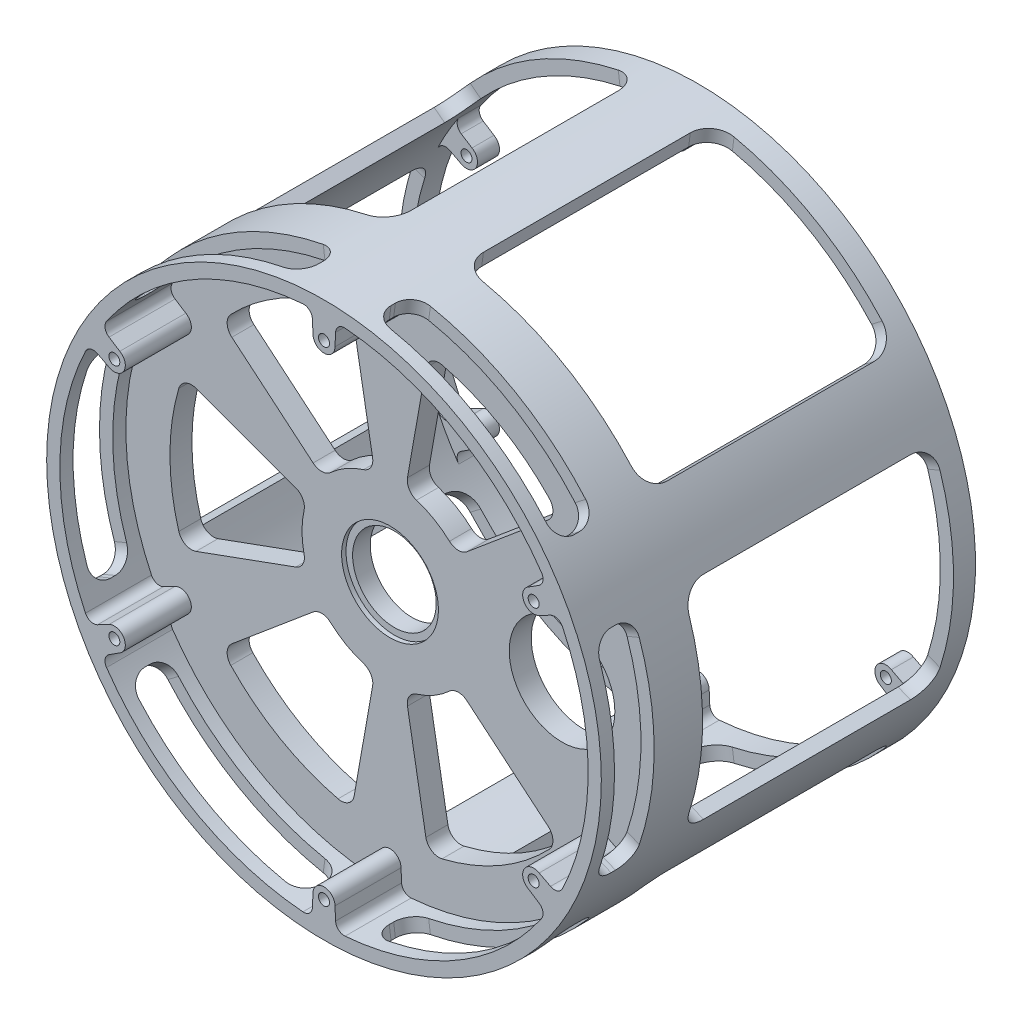
from build123d import *

# Parameters (mm, degrees)
SKETCH_1_R           = 63
SKETCH_1_R_2         = 55
EXTRUDE_1_DEPTH      = 3
SKETCH_3_R           = 63
SKETCH_3_R_2         = 1.25
EXTRUDE_2_DEPTH      = 65
SKETCH_4_R           = 63
CUT_EXTRUDE_2_DEPTH  = 3
SKETCH_5_R           = 63
SKETCH_5_R_2         = 60
EXTRUDE_3_DEPTH      = 3
FILLET_1_R           = 2
CUT_EXTRUDE_START    = -57
CUT_EXTRUDE_3_DEPTH  = 57
FILLET_2_R           = 5
SKETCH_7_R           = 63
EXTRUDE_4_DEPTH      = 5
SKETCH_8_R           = 9.5
CUT_EXTRUDE_4_DEPTH  = 5
SKETCH_9_R           = 11
CUT_EXTRUDE_5_DEPTH  = 1
SKETCH_11_R          = 63
SKETCH_11_R_2        = 1.25
EXTRUDE_6_DEPTH      = 15
FILLET_3_R           = 2
SKETCH_12_R          = 12
CUT_EXTRUDE_6_DEPTH  = 5
CUT_EXTRUDE_START_2  = -9
CUT_EXTRUDE_7_DEPTH  = 9
FILLET_4_R           = 4
CUT_EXTRUDE_8_REACH  = 115.305
FILLET_5_R           = 3
CUT_EXTRUDE_START_3  = 60
SKETCH_16_R          = 60
CUT_EXTRUDE_11_DEPTH = 60


with BuildPart() as part:
    # 草图1 → 凸台-拉伸1 (new body)
    with BuildSketch(Plane.XY):
        Circle(SKETCH_1_R)
        Circle(SKETCH_1_R_2, mode=Mode.SUBTRACT)
    extrude(amount=EXTRUDE_1_DEPTH)

    # 草图3 → 凸台-拉伸2 (add)
    with BuildSketch(Plane.XY.offset(3)):
        Circle(SKETCH_3_R)
        with Locations((0, 55)):
            Circle(SKETCH_3_R_2, mode=Mode.SUBTRACT)
        with Locations((47.631397208, 27.5)):
            Circle(SKETCH_3_R_2, mode=Mode.SUBTRACT)
        with Locations((47.631397208, -27.5)):
            Circle(SKETCH_3_R_2, mode=Mode.SUBTRACT)
        with Locations((0, -55)):
            Circle(SKETCH_3_R_2, mode=Mode.SUBTRACT)
        with Locations((-47.631397208, -27.5)):
            Circle(SKETCH_3_R_2, mode=Mode.SUBTRACT)
        with Locations((-47.631397208, 27.5)):
            Circle(SKETCH_3_R_2, mode=Mode.SUBTRACT)
        with BuildLine():
            Line((-2.5, 55), (-2.724459655, 59.938112413))
            ThreePointArc((-2.724459655, 59.938112413), (-30, 51.961524227), (-50.545698177, 32.328507479))
            Line((-50.545698177, 32.328507479), (-46.381397208, 29.665063509))
            ThreePointArc((-46.381397208, 29.665063509), (-45.466333699, 26.25), (-48.881397208, 25.334936491))
            Line((-48.881397208, 25.334936491), (-53.270157832, 27.609604933))
            ThreePointArc((-53.270157832, 27.609604933), (-60, 0), (-53.270157832, -27.609604933))
            Line((-53.270157832, -27.609604933), (-48.881397208, -25.334936491))
            ThreePointArc((-48.881397208, -25.334936491), (-45.466333699, -26.25), (-46.381397208, -29.665063509))
            Line((-46.381397208, -29.665063509), (-50.545698177, -32.328507479))
            ThreePointArc((-50.545698177, -32.328507479), (-30, -51.961524227), (-2.724459655, -59.938112413))
            Line((-2.724459655, -59.938112413), (-2.5, -55))
            ThreePointArc((-2.5, -55), (0, -52.5), (2.5, -55))
            Line((2.5, -55), (2.724459655, -59.938112413))
            ThreePointArc((2.724459655, -59.938112413), (30, -51.961524227), (50.545698177, -32.328507479))
            Line((50.545698177, -32.328507479), (46.381397208, -29.665063509))
            ThreePointArc((46.381397208, -29.665063509), (45.466333699, -26.25), (48.881397208, -25.334936491))
            Line((48.881397208, -25.334936491), (53.270157832, -27.609604933))
            ThreePointArc((53.270157832, -27.609604933), (60, 0), (53.270157832, 27.609604933))
            Line((53.270157832, 27.609604933), (48.881397208, 25.334936491))
            ThreePointArc((48.881397208, 25.334936491), (45.466333699, 26.25), (46.381397208, 29.665063509))
            Line((46.381397208, 29.665063509), (50.545698177, 32.328507479))
            ThreePointArc((50.545698177, 32.328507479), (30, 51.961524227), (2.724459655, 59.938112413))
            Line((2.724459655, 59.938112413), (2.5, 55))
            ThreePointArc((2.5, 55), (0, 52.5), (-2.5, 55))
        make_face(mode=Mode.SUBTRACT)
    extrude(amount=EXTRUDE_2_DEPTH)

    # 草图4 → 切除-拉伸2 (cut)
    with BuildSketch(Plane(origin=(0, 0, 0), x_dir=(-1, 0, 0), z_dir=(0, 0, -1))):
        Circle(SKETCH_4_R)
    extrude(amount=-CUT_EXTRUDE_2_DEPTH, mode=Mode.SUBTRACT)

    # 草图5 → 凸台-拉伸3 (add)
    with BuildSketch(Plane(origin=(0, 0, 3), x_dir=(-1, 0, 0), z_dir=(0, 0, -1))):
        Circle(SKETCH_5_R)
        Circle(SKETCH_5_R_2, mode=Mode.SUBTRACT)
    extrude(amount=-EXTRUDE_3_DEPTH)

    # 圆角1
    fillet_1_edges = [part.edges().sort_by_distance(p)[0] for p in [
        (-2.724459655, -59.938112413, 35.5),
        (2.724459655, -59.938112413, 35.5),
        (-53.270157832, -27.609604933, 35.5),
        (-50.545698177, -32.328507479, 35.5),
        (-50.545698177, 32.328507479, 35.5),
        (-53.270157832, 27.609604933, 35.5),
        (53.270157832, -27.609604933, 35.5),
        (50.545698177, -32.328507479, 35.5),
        (50.545698177, 32.328507479, 35.5),
        (53.270157832, 27.609604933, 35.5),
        (2.724459655, 59.938112413, 35.5),
        (-2.724459655, 59.938112413, 35.5),
    ]]
    fillet(fillet_1_edges, radius=FILLET_1_R)

    # 草图6 → 切除-拉伸3 (cut)
    with BuildSketch(Plane.XY.offset(65).offset(CUT_EXTRUDE_START)):
        with BuildLine():
            Line((-7.831571533, 59.486691682), (-8.22315011, 62.461026267))
            ThreePointArc((-8.22315011, 62.461026267), (-31.5, 54.559600438), (-49.981260438, 38.351970028))
            Line((-49.981260438, 38.351970028), (-47.601200417, 36.525685741))
            ThreePointArc((-47.601200417, 36.525685741), (-30, 51.961524227), (-7.831571533, 59.486691682))
        make_face()
        with BuildLine():
            Line((7.831571533, 59.486691682), (8.22315011, 62.461026267))
            ThreePointArc((8.22315011, 62.461026267), (31.5, 54.559600438), (49.981260438, 38.351970028))
            Line((49.981260438, 38.351970028), (47.601200417, 36.525685741))
            ThreePointArc((47.601200417, 36.525685741), (30, 51.961524227), (7.831571533, 59.486691682))
        make_face()
        with BuildLine():
            Line((55.432771951, 22.961005942), (58.204410548, 24.109056239))
            ThreePointArc((58.204410548, 24.109056239), (63, 0), (58.204410548, -24.109056239))
            Line((58.204410548, -24.109056239), (55.432771951, -22.961005942))
            ThreePointArc((55.432771951, -22.961005942), (60, 0), (55.432771951, 22.961005942))
        make_face()
        with BuildLine():
            Line((47.601200417, -36.525685741), (49.981260438, -38.351970028))
            ThreePointArc((49.981260438, -38.351970028), (31.5, -54.559600438), (8.22315011, -62.461026267))
            Line((8.22315011, -62.461026267), (7.831571533, -59.486691682))
            ThreePointArc((7.831571533, -59.486691682), (30, -51.961524227), (47.601200417, -36.525685741))
        make_face()
        with BuildLine():
            Line((-7.831571533, -59.486691682), (-8.22315011, -62.461026267))
            ThreePointArc((-8.22315011, -62.461026267), (-31.5, -54.559600438), (-49.981260438, -38.351970028))
            Line((-49.981260438, -38.351970028), (-47.601200417, -36.525685741))
            ThreePointArc((-47.601200417, -36.525685741), (-30, -51.961524227), (-7.831571533, -59.486691682))
        make_face()
        with BuildLine():
            Line((-55.432771951, -22.961005942), (-58.204410548, -24.109056239))
            ThreePointArc((-58.204410548, -24.109056239), (-63, 0), (-58.204410548, 24.109056239))
            Line((-58.204410548, 24.109056239), (-55.432771951, 22.961005942))
            ThreePointArc((-55.432771951, 22.961005942), (-60, 0), (-55.432771951, -22.961005942))
        make_face()
    extrude(amount=CUT_EXTRUDE_3_DEPTH, mode=Mode.SUBTRACT)

    # 圆角2
    fillet_2_edges = [part.edges().sort_by_distance(p)[0] for p in [
        (48.791230428, 37.438827884, 65),
        (8.027360822, 60.973858974, 65),
        (8.027360822, 60.973858974, 8),
        (48.791230428, 37.438827884, 8),
        (-8.027360822, 60.973858974, 65),
        (-48.791230428, 37.438827884, 65),
        (-48.791230428, 37.438827884, 8),
        (-8.027360822, 60.973858974, 8),
        (-56.818591249, 23.53503109, 65),
        (-56.818591249, -23.53503109, 65),
        (-56.818591249, -23.53503109, 8),
        (-56.818591249, 23.53503109, 8),
        (-48.791230428, -37.438827884, 65),
        (-8.027360822, -60.973858974, 65),
        (-8.027360822, -60.973858974, 8),
        (-48.791230428, -37.438827884, 8),
        (8.027360822, -60.973858974, 65),
        (48.791230428, -37.438827884, 65),
        (48.791230428, -37.438827884, 8),
        (8.027360822, -60.973858974, 8),
        (56.818591249, -23.53503109, 65),
        (56.818591249, 23.53503109, 65),
        (56.818591249, 23.53503109, 8),
        (56.818591249, -23.53503109, 8),
    ]]
    fillet(fillet_2_edges, radius=FILLET_2_R)

    # 草图7 → 凸台-拉伸4 (add)
    with BuildSketch(Plane.XY.offset(68)):
        Circle(SKETCH_7_R)
    extrude(amount=EXTRUDE_4_DEPTH)

    # 草图8 → 切除-拉伸4 (cut)
    with BuildSketch(Plane.XY.offset(73)):
        Circle(SKETCH_8_R)
    extrude(amount=-CUT_EXTRUDE_4_DEPTH, mode=Mode.SUBTRACT)

    # 草图9 → 切除-拉伸5 (cut)
    with BuildSketch(Plane.XY.offset(73)):
        Circle(SKETCH_9_R)
    extrude(amount=-CUT_EXTRUDE_5_DEPTH, mode=Mode.SUBTRACT)

    # 草图11 → 凸台-拉伸6 (add)
    with BuildSketch(Plane.XY.offset(73)):
        Circle(SKETCH_11_R)
        with Locations((0, 55)):
            Circle(SKETCH_11_R_2, mode=Mode.SUBTRACT)
        with Locations((47.631397208, 27.5)):
            Circle(SKETCH_11_R_2, mode=Mode.SUBTRACT)
        with Locations((47.631397208, -27.5)):
            Circle(SKETCH_11_R_2, mode=Mode.SUBTRACT)
        with Locations((0, -55)):
            Circle(SKETCH_11_R_2, mode=Mode.SUBTRACT)
        with Locations((-47.631397208, -27.5)):
            Circle(SKETCH_11_R_2, mode=Mode.SUBTRACT)
        with Locations((-47.631397208, 27.5)):
            Circle(SKETCH_11_R_2, mode=Mode.SUBTRACT)
        with BuildLine():
            Line((-2.5, 55), (-2.724459655, 59.938112413))
            ThreePointArc((-2.724459655, 59.938112413), (-30, 51.961524227), (-50.545698177, 32.328507479))
            Line((-50.545698177, 32.328507479), (-46.381397208, 29.665063509))
            ThreePointArc((-46.381397208, 29.665063509), (-45.466333699, 26.25), (-48.881397208, 25.334936491))
            Line((-48.881397208, 25.334936491), (-53.270157832, 27.609604933))
            ThreePointArc((-53.270157832, 27.609604933), (-60, 0), (-53.270157832, -27.609604933))
            Line((-53.270157832, -27.609604933), (-48.881397208, -25.334936491))
            ThreePointArc((-48.881397208, -25.334936491), (-45.466333699, -26.25), (-46.381397208, -29.665063509))
            Line((-46.381397208, -29.665063509), (-50.545698177, -32.328507479))
            ThreePointArc((-50.545698177, -32.328507479), (-30, -51.961524227), (-2.724459655, -59.938112413))
            Line((-2.724459655, -59.938112413), (-2.5, -55))
            ThreePointArc((-2.5, -55), (0, -52.5), (2.5, -55))
            Line((2.5, -55), (2.724459655, -59.938112413))
            ThreePointArc((2.724459655, -59.938112413), (30, -51.961524227), (50.545698177, -32.328507479))
            Line((50.545698177, -32.328507479), (46.381397208, -29.665063509))
            ThreePointArc((46.381397208, -29.665063509), (45.466333699, -26.25), (48.881397208, -25.334936491))
            Line((48.881397208, -25.334936491), (53.270157832, -27.609604933))
            ThreePointArc((53.270157832, -27.609604933), (60, 0), (53.270157832, 27.609604933))
            Line((53.270157832, 27.609604933), (48.881397208, 25.334936491))
            ThreePointArc((48.881397208, 25.334936491), (45.466333699, 26.25), (46.381397208, 29.665063509))
            Line((46.381397208, 29.665063509), (50.545698177, 32.328507479))
            ThreePointArc((50.545698177, 32.328507479), (30, 51.961524227), (2.724459655, 59.938112413))
            Line((2.724459655, 59.938112413), (2.5, 55))
            ThreePointArc((2.5, 55), (0, 52.5), (-2.5, 55))
        make_face(mode=Mode.SUBTRACT)
    extrude(amount=EXTRUDE_6_DEPTH)

    # 圆角3
    fillet_3_edges = [part.edges().sort_by_distance(p)[0] for p in [
        (-50.545698177, -32.328507479, 80.5),
        (-53.270157832, -27.609604933, 80.5),
        (2.724459655, -59.938112413, 80.5),
        (-2.724459655, -59.938112413, 80.5),
        (53.270157832, -27.609604933, 80.5),
        (50.545698177, -32.328507479, 80.5),
        (50.545698177, 32.328507479, 80.5),
        (53.270157832, 27.609604933, 80.5),
        (-2.724459655, 59.938112413, 80.5),
        (2.724459655, 59.938112413, 80.5),
        (-50.545698177, 32.328507479, 80.5),
        (-53.270157832, 27.609604933, 80.5),
    ]]
    fillet(fillet_3_edges, radius=FILLET_3_R)

    # 草图12 → 切除-拉伸6 (cut)
    with BuildSketch(Plane.XY.offset(73)):
        with Locations((39.073033018, 0)):
            Circle(SKETCH_12_R)
    extrude(amount=-CUT_EXTRUDE_6_DEPTH, mode=Mode.SUBTRACT)

    # 草图13 → 切除-拉伸7 (cut)
    with BuildSketch(Plane.XY.offset(85).offset(CUT_EXTRUDE_START_2)):
        with BuildLine():
            Line((-7.831571533, 59.486691682), (-8.22315011, 62.461026267))
            ThreePointArc((-8.22315011, 62.461026267), (-31.5, 54.559600438), (-49.981260438, 38.351970028))
            Line((-49.981260438, 38.351970028), (-47.601200417, 36.525685741))
            ThreePointArc((-47.601200417, 36.525685741), (-30, 51.961524227), (-7.831571533, 59.486691682))
        make_face()
        with BuildLine():
            Line((7.831571533, 59.486691682), (8.22315011, 62.461026267))
            ThreePointArc((8.22315011, 62.461026267), (31.5, 54.559600438), (49.981260438, 38.351970028))
            Line((49.981260438, 38.351970028), (47.601200417, 36.525685741))
            ThreePointArc((47.601200417, 36.525685741), (30, 51.961524227), (7.831571533, 59.486691682))
        make_face()
        with BuildLine():
            Line((55.432771951, 22.961005942), (58.204410548, 24.109056239))
            ThreePointArc((58.204410548, 24.109056239), (63, 0), (58.204410548, -24.109056239))
            Line((58.204410548, -24.109056239), (55.432771951, -22.961005942))
            ThreePointArc((55.432771951, -22.961005942), (60, 0), (55.432771951, 22.961005942))
        make_face()
        with BuildLine():
            Line((47.601200417, -36.525685741), (49.981260438, -38.351970028))
            ThreePointArc((49.981260438, -38.351970028), (31.5, -54.559600438), (8.22315011, -62.461026267))
            Line((8.22315011, -62.461026267), (7.831571533, -59.486691682))
            ThreePointArc((7.831571533, -59.486691682), (30, -51.961524227), (47.601200417, -36.525685741))
        make_face()
        with BuildLine():
            Line((-7.831571533, -59.486691682), (-8.22315011, -62.461026267))
            ThreePointArc((-8.22315011, -62.461026267), (-31.5, -54.559600438), (-49.981260438, -38.351970028))
            Line((-49.981260438, -38.351970028), (-47.601200417, -36.525685741))
            ThreePointArc((-47.601200417, -36.525685741), (-30, -51.961524227), (-7.831571533, -59.486691682))
        make_face()
        with BuildLine():
            Line((-55.432771951, -22.961005942), (-58.204410548, -24.109056239))
            ThreePointArc((-58.204410548, -24.109056239), (-63, 0), (-58.204410548, 24.109056239))
            Line((-58.204410548, 24.109056239), (-55.432771951, 22.961005942))
            ThreePointArc((-55.432771951, 22.961005942), (-60, 0), (-55.432771951, -22.961005942))
        make_face()
    extrude(amount=CUT_EXTRUDE_7_DEPTH, mode=Mode.SUBTRACT)

    # 圆角4
    fillet_4_edges = [part.edges().sort_by_distance(p)[0] for p in [
        (-56.818591249, -23.53503109, 85),
        (-56.818591249, -23.53503109, 76),
        (-56.818591249, 23.53503109, 76),
        (-56.818591249, 23.53503109, 85),
        (-8.027360822, -60.973858974, 85),
        (-8.027360822, -60.973858974, 76),
        (-48.791230428, -37.438827884, 76),
        (-48.791230428, -37.438827884, 85),
        (48.791230428, -37.438827884, 85),
        (48.791230428, -37.438827884, 76),
        (8.027360822, -60.973858974, 76),
        (8.027360822, -60.973858974, 85),
        (56.818591249, 23.53503109, 85),
        (56.818591249, 23.53503109, 76),
        (56.818591249, -23.53503109, 76),
        (56.818591249, -23.53503109, 85),
        (8.027360822, 60.973858974, 85),
        (8.027360822, 60.973858974, 76),
        (48.791230428, 37.438827884, 76),
        (48.791230428, 37.438827884, 85),
        (-48.791230428, 37.438827884, 85),
        (-48.791230428, 37.438827884, 76),
        (-8.027360822, 60.973858974, 76),
        (-8.027360822, 60.973858974, 85),
    ]]
    fillet(fillet_4_edges, radius=FILLET_4_R)

    # 草图14 → 切除-拉伸8 (cut, up to next)
    with BuildSketch(Plane.XY.offset(73), mode=Mode.PRIVATE) as cut_extrude_8_sk1:
        with BuildLine():
            Line((-3.472963553, 19.69615506), (-8.682408883, 49.240387651))
            ThreePointArc((-8.682408883, 49.240387651), (-25, 43.301270189), (-38.302222156, 32.139380484))
            Line((-38.302222156, 32.139380484), (-15.320888862, 12.855752194))
            ThreePointArc((-15.320888862, 12.855752194), (-10, 17.320508076), (-3.472963553, 19.69615506))
        make_face()
    cut_extrude_8_tool1 = extrude(cut_extrude_8_sk1.sketch, amount=-CUT_EXTRUDE_8_REACH, mode=Mode.PRIVATE) & part.part
    # 草图14 → 切除-拉伸8 (cut, up to next)
    with BuildSketch(Plane.XY.offset(73), mode=Mode.PRIVATE) as cut_extrude_8_sk2:
        with BuildLine():
            Line((3.472963553, 19.69615506), (8.682408883, 49.240387651))
            ThreePointArc((8.682408883, 49.240387651), (25, 43.301270189), (38.302222156, 32.139380484))
            Line((38.302222156, 32.139380484), (15.320888862, 12.855752194))
            ThreePointArc((15.320888862, 12.855752194), (10, 17.320508076), (3.472963553, 19.69615506))
        make_face()
    cut_extrude_8_tool2 = extrude(cut_extrude_8_sk2.sketch, amount=-CUT_EXTRUDE_8_REACH, mode=Mode.PRIVATE) & part.part
    # 草图14 → 切除-拉伸8 (cut, up to next)
    with BuildSketch(Plane.XY.offset(73), mode=Mode.PRIVATE) as cut_extrude_8_sk3:
        with BuildLine():
            Line((15.320888862, -12.855752194), (38.302222156, -32.139380484))
            ThreePointArc((38.302222156, -32.139380484), (25, -43.301270189), (8.682408883, -49.240387651))
            Line((8.682408883, -49.240387651), (3.472963553, -19.69615506))
            ThreePointArc((3.472963553, -19.69615506), (10, -17.320508076), (15.320888862, -12.855752194))
        make_face()
    cut_extrude_8_tool3 = extrude(cut_extrude_8_sk3.sketch, amount=-CUT_EXTRUDE_8_REACH, mode=Mode.PRIVATE) & part.part
    # 草图14 → 切除-拉伸8 (cut, up to next)
    with BuildSketch(Plane.XY.offset(73), mode=Mode.PRIVATE) as cut_extrude_8_sk4:
        with BuildLine():
            Line((-3.472963553, -19.69615506), (-8.682408883, -49.240387651))
            ThreePointArc((-8.682408883, -49.240387651), (-25, -43.301270189), (-38.302222156, -32.139380484))
            Line((-38.302222156, -32.139380484), (-15.320888862, -12.855752194))
            ThreePointArc((-15.320888862, -12.855752194), (-10, -17.320508076), (-3.472963553, -19.69615506))
        make_face()
    cut_extrude_8_tool4 = extrude(cut_extrude_8_sk4.sketch, amount=-CUT_EXTRUDE_8_REACH, mode=Mode.PRIVATE) & part.part
    # 草图14 → 切除-拉伸8 (cut, up to next)
    with BuildSketch(Plane.XY.offset(73), mode=Mode.PRIVATE) as cut_extrude_8_sk5:
        with BuildLine():
            Line((-18.793852416, -6.840402867), (-46.984631039, -17.101007166))
            ThreePointArc((-46.984631039, -17.101007166), (-50, 0), (-46.984631039, 17.101007166))
            Line((-46.984631039, 17.101007166), (-18.793852416, 6.840402867))
            ThreePointArc((-18.793852416, 6.840402867), (-20, 0), (-18.793852416, -6.840402867))
        make_face()
    cut_extrude_8_tool5 = extrude(cut_extrude_8_sk5.sketch, amount=-CUT_EXTRUDE_8_REACH, mode=Mode.PRIVATE) & part.part
    add(cut_extrude_8_tool1.solids().sort_by_distance((-18.196574, 31.517391, 73))[0], mode=Mode.SUBTRACT)
    add(cut_extrude_8_tool2.solids().sort_by_distance((18.196574, 31.517391, 73))[0], mode=Mode.SUBTRACT)
    add(cut_extrude_8_tool3.solids().sort_by_distance((18.196574, -31.517391, 73))[0], mode=Mode.SUBTRACT)
    add(cut_extrude_8_tool4.solids().sort_by_distance((-18.196574, -31.517391, 73))[0], mode=Mode.SUBTRACT)
    add(cut_extrude_8_tool5.solids().sort_by_distance((-36.393148, 0, 73))[0], mode=Mode.SUBTRACT)

    # 圆角5
    fillet_5_edges = [part.edges().sort_by_distance(p)[0] for p in [
        (-3.472963553, 19.69615506, 70.5),
        (-15.320888862, 12.855752194, 70.5),
        (-38.302222156, 32.139380484, 70.5),
        (15.320888862, 12.855752194, 70.5),
        (3.472963553, 19.69615506, 70.5),
        (8.682408883, 49.240387651, 70.5),
        (38.302222156, 32.139380484, 70.5),
        (3.472963553, -19.69615506, 70.5),
        (15.320888862, -12.855752194, 70.5),
        (38.302222156, -32.139380484, 70.5),
        (8.682408883, -49.240387651, 70.5),
        (-18.793852416, 6.840402867, 70.5),
        (-18.793852416, -6.840402867, 70.5),
        (-46.984631039, -17.101007166, 70.5),
        (-46.984631039, 17.101007166, 70.5),
        (-15.320888862, -12.855752194, 70.5),
        (-3.472963553, -19.69615506, 70.5),
        (-8.682408883, -49.240387651, 70.5),
        (-38.302222156, -32.139380484, 70.5),
        (-8.682408883, 49.240387651, 70.5),
    ]]
    fillet(fillet_5_edges, radius=FILLET_5_R)

    # 草图16 → 切除-拉伸11 (cut)
    with BuildSketch(Plane(origin=(0, 0, 68), x_dir=(-1, 0, 0), z_dir=(0, 0, -1)).offset(CUT_EXTRUDE_START_3)):
        Circle(SKETCH_16_R)
    extrude(amount=-CUT_EXTRUDE_11_DEPTH, mode=Mode.SUBTRACT)


solid = part.part
